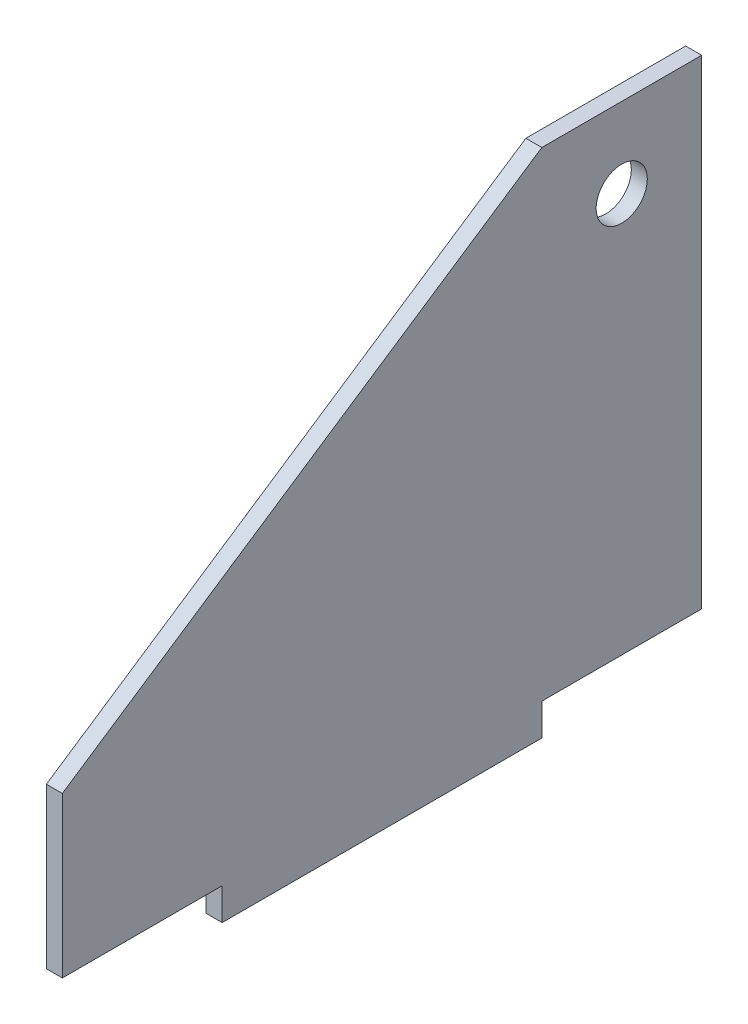
from build123d import *

# Parameters (mm, degrees)
CROQUIS1_R              = 8
SALIENTE_EXTRUIR1_DEPTH = 5


with BuildPart() as part:
    # Croquis1 → Saliente-Extruir1 (new body)
    with BuildSketch(Plane(origin=(0, 0, 0), x_dir=(0, 0, -1), z_dir=(1, 0, 0))):
        Polygon((50, 75), (-100, -25), (-100, -75), (-50, -75), (-50, -85), (50, -85), (50, -75), (100, -75), (100, 75), align=None)
        with Locations((75, 50)):
            Circle(CROQUIS1_R, mode=Mode.SUBTRACT)
    extrude(amount=SALIENTE_EXTRUIR1_DEPTH)


solid = part.part
